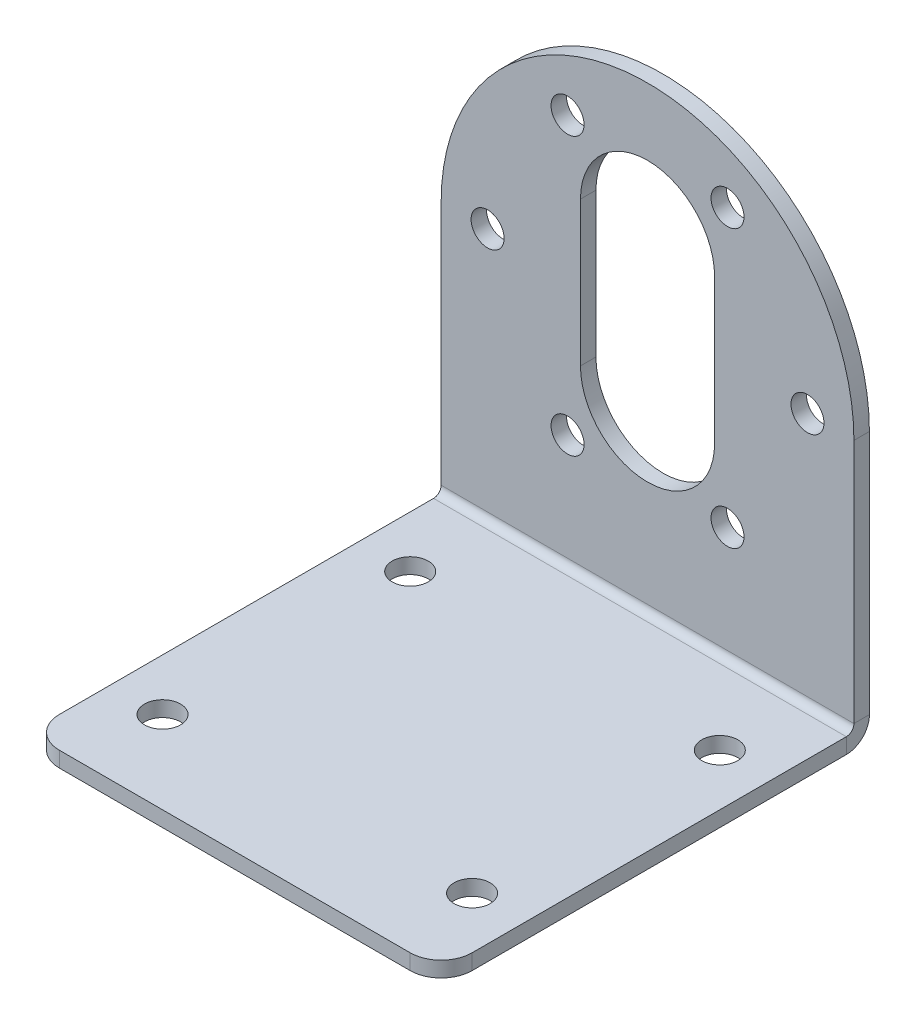
from build123d import *

# Parameters (mm, degrees)
SM_BASE_FLANGE_1_DEPTH           = 1.5
SM_EDGE_FLANGE_1_STRIP_W         = 7.4732
SM_EDGE_FLANGE_1_STRIP_H         = 1.5
SM_EDGE_FLANGE_1_STRIP_CUT_DEPTH = 40
SM_EDGE_FLANGE_1_DEPTH           = 40
CUT_EXTRUDE_1_DEPTH              = 10
SKETCH_10_R                      = 1.6
CUT_EXTRUDE_2_DEPTH              = 10
SKETCH_11_R                      = 1.75
CUT_EXTRUDE_3_DEPTH              = 10


# Sheet-metal steps are written as plain solids
with BuildPart() as part:
    # Sketch 1 → 基体-法兰1 (new body)
    with BuildSketch(Plane(origin=(0, 0, 0), x_dir=(1, 0, 0), z_dir=(0, 1, 0))):
        with BuildLine():
            Line((-17, -20), (17, -20))
            ThreePointArc((17, -20), (19.121320344, -19.121320344), (20, -17))
            Line((20, -17), (20, 20))
            Line((20, 20), (-20, 20))
            Line((-20, 20), (-20, -17))
            ThreePointArc((-20, -17), (-19.121320344, -19.121320344), (-17, -20))
        make_face()
    extrude(amount=-SM_BASE_FLANGE_1_DEPTH)

    # 边线-法兰1 strip (across the edge) → 边线-法兰1 strip cut (cut)
    with BuildSketch(Plane(origin=(20, 0, -20), x_dir=(0, 0, 1), z_dir=(-1, 0, 0))):
        with Locations((-3, -0.75)):
            Rectangle(SM_EDGE_FLANGE_1_STRIP_W, SM_EDGE_FLANGE_1_STRIP_H)
    extrude(amount=SM_EDGE_FLANGE_1_STRIP_CUT_DEPTH, mode=Mode.SUBTRACT)

    # 边线-法兰1 section (across the edge) → 边线-法兰1 (add)
    with BuildSketch(Plane(origin=(20, 0, -20), x_dir=(0, 0, 1), z_dir=(-1, 0, 0))):
        with BuildLine():
            Line((-1.5, 0.7366), (-1.5, 44.5))
            Line((-1.5, 44.5), (0, 44.5))
            Line((0, 44.5), (0, 0.7366))
            ThreePointArc((0, 0.7366), (0.215745145, 0.215745145), (0.7366, 0))
            Line((0.7366, 0), (0.7366, -1.5))
            ThreePointArc((0.7366, -1.5), (-0.844915027, -0.844915027), (-1.5, 0.7366))
        make_face()
    extrude(amount=SM_EDGE_FLANGE_1_DEPTH)

    # 草图9 → 切除-拉伸1 (cut)
    with BuildSketch(Plane(origin=(0, 0, -21.5), x_dir=(-1, 0, 0), z_dir=(0, 0, -1))):
        with BuildLine():
            Line((-20, 24.5), (-20, 44.5))
            Line((-20, 44.5), (25.146997012, 48.516846867))
            Line((25.146997012, 48.516846867), (20, 24.5))
            ThreePointArc((20, 24.5), (0, 44.5), (-20, 24.5))
        make_face()
    extrude(amount=-CUT_EXTRUDE_1_DEPTH, mode=Mode.SUBTRACT)

    # 草图10 → 切除-拉伸2 (cut)
    with BuildSketch(Plane(origin=(0, 0, -21.5), x_dir=(-1, 0, 0), z_dir=(0, 0, -1))):
        with Locations(Location((7.75, 37.923393759, 0), (0, 0, 90))):
            Circle(SKETCH_10_R)
        with Locations(Location((15.5, 24.5, 0), (0, 0, 90))):
            Circle(SKETCH_10_R)
        with Locations(Location((7.75, 11.076606241, 0), (0, 0, 90))):
            Circle(SKETCH_10_R)
        with Locations(Location((-7.75, 11.076606241, 0), (0, 0, 90))):
            Circle(SKETCH_10_R)
        with Locations(Location((-15.5, 24.5, 0), (0, 0, 90))):
            Circle(SKETCH_10_R)
        with Locations(Location((-7.75, 37.923393759, 0), (0, 0, 90))):
            Circle(SKETCH_10_R)
        with BuildLine():
            Line((-6.5, 17.5), (-6.5, 31.5))
            ThreePointArc((-6.5, 31.5), (0, 38), (6.5, 31.5))
            Line((6.5, 31.5), (6.5, 17.5))
            ThreePointArc((6.5, 17.5), (0, 11), (-6.5, 17.5))
        make_face()
    extrude(amount=-CUT_EXTRUDE_2_DEPTH, mode=Mode.SUBTRACT)

    # 草图11 → 切除-拉伸3 (cut)
    with BuildSketch(Plane.XZ.offset(1.5)):
        with Locations(Location((15, 12, 0), (0, 0, 270))):
            Circle(SKETCH_11_R)
        with Locations(Location((-15, 12, 0), (0, 0, 270))):
            Circle(SKETCH_11_R)
        with Locations(Location((-15, -12, 0), (0, 0, 270))):
            Circle(SKETCH_11_R)
        with Locations(Location((15, -12, 0), (0, 0, 270))):
            Circle(SKETCH_11_R)
    extrude(amount=-CUT_EXTRUDE_3_DEPTH, mode=Mode.SUBTRACT)


solid = part.part
